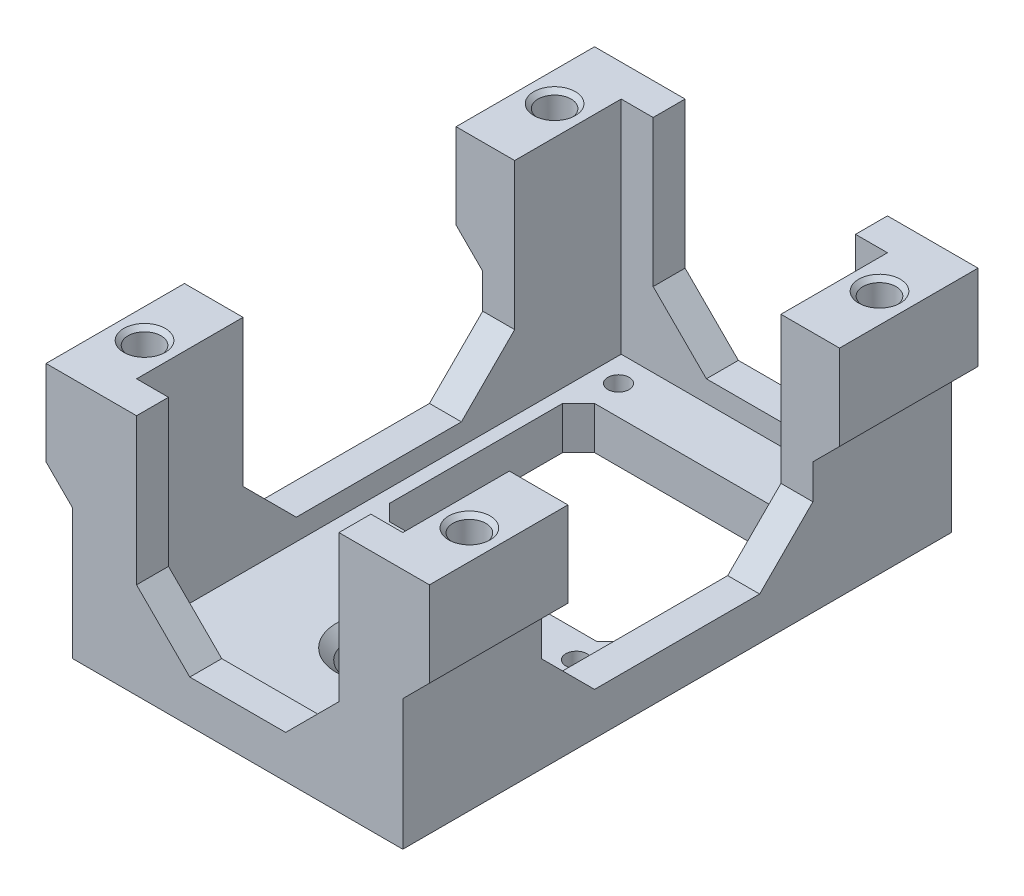
from build123d import *

# Parameters (mm, degrees)
SKETCH1_W                                  = 25
SKETCH1_H                                  = 45.5
BOSS_EXTRUDE1_DEPTH                        = 4
SKETCH2_R                                  = 1
CUT_EXTRUDE1_DEPTH                         = 27.264281829
SKETCH3_W                                  = 22.5
SKETCH3_H                                  = 19.25
CUT_EXTRUDE2_DEPTH                         = 4
CHAMFER1_SIZE                              = 1.5
SKETCH4_R                                  = 3
CUT_EXTRUDE3_DEPTH                         = 27.264281829
SKETCH11_W                                 = 31
SKETCH11_H                                 = 51.5
SKETCH11_W_2                               = 25
SKETCH11_H_2                               = 45.5
BOSS_EXTRUDE5_DEPTH                        = 6
BOSS_EXTRUDE6_DEPTH                        = 18.75
SKETCH14_W                                 = 5.5
SKETCH14_H                                 = 13
BOSS_EXTRUDE7_DEPTH                        = 8
SKETCH15_R                                 = 1.55
CUT_EXTRUDE5_DEPTH                         = 3
MIRROR2_AT_THE_SECOND_PLANE_COPY_1_DEPTH   = 18.75
MIRROR2_AT_THE_SECOND_PLANE_COPY_2_SKETC_W = 5.5
MIRROR2_AT_THE_SECOND_PLANE_COPY_2_SKETC_H = 13
MIRROR2_AT_THE_SECOND_PLANE_COPY_2_DEPTH   = 8
MIRROR2_AT_THE_SECOND_PLANE_COPY_3_SKETC_R = 1.55
MIRROR2_AT_THE_SECOND_PLANE_COPY_3_DEPTH   = 3
CHAMFER3_SIZE                              = 2.5
CHAMFER4_SIZE                              = 5
CHAMFER5_SIZE                              = 2
SKETCH16_R                                 = 2
CUT_EXTRUDE6_DEPTH                         = 1.5
CHAMFER6_SIZE                              = 1
CHAMFER7_SIZE                              = 0.4
SKETCH17_R                                 = 1
CUT_EXTRUDE7_DEPTH                         = 4


with BuildPart() as part:
    # Sketch1 → Boss-Extrude1 (new body)
    with BuildSketch(Plane(origin=(0, 0, 0), x_dir=(1, 0, 0), z_dir=(0, 1, 0))):
        Rectangle(SKETCH1_W, SKETCH1_H)
    extrude(amount=BOSS_EXTRUDE1_DEPTH)

    # Sketch2 → Cut-Extrude1 (cut, through all)
    with BuildSketch(Plane(origin=(0, 4, 0), x_dir=(1, 0, 0), z_dir=(0, 1, 0))):
        with Locations(Location((-10.25, 20.25, 0), (0, 0, 270))):
            Circle(SKETCH2_R)
        with Locations(Location((10.25, 20.25, 0), (0, 0, 270))):
            Circle(SKETCH2_R)
        with Locations(Location((10.25, -4.2, 0), (0, 0, 270))):
            Circle(SKETCH2_R)
        with Locations(Location((-10.25, -4.2, 0), (0, 0, 270))):
            Circle(SKETCH2_R)
    extrude(amount=-CUT_EXTRUDE1_DEPTH, mode=Mode.SUBTRACT)

    # Sketch3 → Cut-Extrude2 (cut)
    with BuildSketch(Plane(origin=(0, 4, 0), x_dir=(1, 0, 0), z_dir=(0, 1, 0))):
        with Locations((0, 7.875)):
            Rectangle(SKETCH3_W, SKETCH3_H)
    extrude(amount=-CUT_EXTRUDE2_DEPTH, mode=Mode.SUBTRACT)

    # Chamfer1
    chamfer1_edges = [part.edges().sort_by_distance(p)[0] for p in [
        (11.25, 2, -17.5),
        (11.25, 2, 1.75),
        (-11.25, 2, 1.75),
        (-11.25, 2, -17.5),
    ]]
    chamfer(chamfer1_edges, length=CHAMFER1_SIZE)

    # Sketch4 → Cut-Extrude3 (cut, through all)
    with BuildSketch(Plane(origin=(0, 4, 0), x_dir=(1, 0, 0), z_dir=(0, 1, 0))):
        with Locations(Location((0, -12.5, 0), (0, 0, 270))):
            Circle(SKETCH4_R)
    extrude(amount=-CUT_EXTRUDE3_DEPTH, mode=Mode.SUBTRACT)

    # Sketch11 → Boss-Extrude5 (add)
    with BuildSketch(Plane.XZ):
        Rectangle(SKETCH11_W, SKETCH11_H)
        Rectangle(SKETCH11_W_2, SKETCH11_H_2, mode=Mode.SUBTRACT)
    extrude(amount=-BOSS_EXTRUDE5_DEPTH)

    # Sketch12 → Boss-Extrude6 (add)
    with BuildSketch(Plane(origin=(0, 6, 0), x_dir=(1, 0, 0), z_dir=(0, 1, 0))):
        Polygon((-15.5, 25.75), (-9.5, 25.75), (-9.5, 22.75), (-12.5, 22.75), (-12.5, 12.75), (-15.5, 12.75), align=None)
    boss_extrude6 = extrude(amount=BOSS_EXTRUDE6_DEPTH)

    # Sketch14 → Boss-Extrude7 (add)
    with BuildSketch(Plane(origin=(0, 24.75, 0), x_dir=(1, 0, 0), z_dir=(0, 1, 0))):
        with Locations((-15.25, 19.25)):
            Rectangle(SKETCH14_W, SKETCH14_H)
    boss_extrude7 = extrude(amount=-BOSS_EXTRUDE7_DEPTH)

    # Sketch15 → Cut-Extrude5 (cut)
    with BuildSketch(Plane(origin=(0, 24.75, 0), x_dir=(1, 0, 0), z_dir=(0, 1, 0))):
        with Locations(Location((-15.25, 19.25, 0), (0, 0, 270))):
            Circle(SKETCH15_R)
    cut_extrude5 = extrude(amount=-CUT_EXTRUDE5_DEPTH, mode=Mode.SUBTRACT)

    # Mirror2: Boss-Extrude6, Boss-Extrude7, Cut-Extrude5 across plane
    add(boss_extrude6.mirror(Plane(origin=(0, 0, 0), x_dir=(0, 0, 1), z_dir=(1, 0, 0))))
    add(boss_extrude7.mirror(Plane(origin=(0, 0, 0), x_dir=(0, 0, 1), z_dir=(1, 0, 0))))
    add(cut_extrude5.mirror(Plane(origin=(0, 0, 0), x_dir=(0, 0, 1), z_dir=(1, 0, 0))), mode=Mode.SUBTRACT)

    # Mirror2 at the second plane: Boss-Extrude6, Boss-Extrude7, Cut-Extrude5 across plane
    add(boss_extrude6.mirror(Plane.XY))
    add(boss_extrude7.mirror(Plane.XY))
    add(cut_extrude5.mirror(Plane.XY), mode=Mode.SUBTRACT)

    # Mirror2 at the second plane copy 1 sketc → Mirror2 at the second plane copy 1 (add)
    with BuildSketch(Plane(origin=(0, 6, 0), x_dir=(-1, 0, 0), z_dir=(0, 1, 0))):
        Polygon((-15.5, 25.75), (-9.5, 25.75), (-9.5, 22.75), (-12.5, 22.75), (-12.5, 12.75), (-15.5, 12.75), align=None)
    extrude(amount=MIRROR2_AT_THE_SECOND_PLANE_COPY_1_DEPTH)

    # Mirror2 at the second plane copy 2 sketc → Mirror2 at the second plane copy 2 (add)
    with BuildSketch(Plane(origin=(0, 24.75, 0), x_dir=(-1, 0, 0), z_dir=(0, 1, 0))):
        with Locations((-15.25, 19.25)):
            Rectangle(MIRROR2_AT_THE_SECOND_PLANE_COPY_2_SKETC_W, MIRROR2_AT_THE_SECOND_PLANE_COPY_2_SKETC_H)
    extrude(amount=-MIRROR2_AT_THE_SECOND_PLANE_COPY_2_DEPTH)

    # Mirror2 at the second plane copy 3 sketc → Mirror2 at the second plane copy 3 (cut)
    with BuildSketch(Plane(origin=(0, 24.75, 0), x_dir=(-1, 0, 0), z_dir=(0, 1, 0))):
        with Locations(Location((-15.25, 19.25, 0), (0, 0, 270))):
            Circle(MIRROR2_AT_THE_SECOND_PLANE_COPY_3_SKETC_R)
    extrude(amount=-MIRROR2_AT_THE_SECOND_PLANE_COPY_3_DEPTH, mode=Mode.SUBTRACT)

    # Chamfer3
    # the kernel refuses this chamfer: 2.5 mm, written as the material it adds along each edge
    with BuildSketch(Plane(origin=(-15.5, 16.75, -12.75), x_dir=(0.027495876610586317, -0.9996219169112968, 0), z_dir=(0, 0, -1))) as chamfer3_piece_1_section:
        Polygon((CHAMFER3_SIZE * 0.999621916911, CHAMFER3_SIZE * 0.0274958766106), (-CHAMFER3_SIZE * 0.0274958766106, CHAMFER3_SIZE * 0.999621916911), (0, 0), align=None)
    chamfer3_piece_1 = extrude(amount=13, mode=Mode.PRIVATE)
    chamfer3_piece_1 = split(chamfer3_piece_1, bisect_by=Plane(origin=(-18, 15.923989614, -19.25), z_dir=(1, 0, 0)), keep=Keep.TOP, mode=Mode.PRIVATE)
    add(chamfer3_piece_1)
    with BuildSketch(Plane(origin=(-15.5, 16.75, 12.75), x_dir=(0.027495876610586317, -0.9996219169112968, 0), z_dir=(0, 0, 1))) as chamfer3_piece_2_section:
        Polygon((CHAMFER3_SIZE * 0.999621916911, -CHAMFER3_SIZE * 0.0274958766106), (-CHAMFER3_SIZE * 0.0274958766106, -CHAMFER3_SIZE * 0.999621916911), (0, 0), align=None)
    chamfer3_piece_2 = extrude(amount=13, mode=Mode.PRIVATE)
    chamfer3_piece_2 = split(chamfer3_piece_2, bisect_by=Plane(origin=(-18, 15.923989614, 19.25), z_dir=(1, 0, 0)), keep=Keep.TOP, mode=Mode.PRIVATE)
    add(chamfer3_piece_2)
    with BuildSketch(Plane(origin=(15.5, 16.75, -12.75), x_dir=(-0.027495876610586317, -0.9996219169112968, 0), z_dir=(0, 0, -1))) as chamfer3_piece_3_section:
        Polygon((CHAMFER3_SIZE * 0.999621916911, -CHAMFER3_SIZE * 0.0274958766106), (-CHAMFER3_SIZE * 0.0274958766106, -CHAMFER3_SIZE * 0.999621916911), (0, 0), align=None)
    chamfer3_piece_3 = extrude(amount=13, mode=Mode.PRIVATE)
    chamfer3_piece_3 = split(chamfer3_piece_3, bisect_by=Plane(origin=(18, 15.923989614, -19.25), z_dir=(-1, 0, 0)), keep=Keep.TOP, mode=Mode.PRIVATE)
    add(chamfer3_piece_3)
    with BuildSketch(Plane(origin=(15.5, 16.75, 12.75), x_dir=(-0.027495876610586317, -0.9996219169112968, 0), z_dir=(0, 0, 1))) as chamfer3_piece_4_section:
        Polygon((CHAMFER3_SIZE * 0.999621916911, CHAMFER3_SIZE * 0.0274958766106), (-CHAMFER3_SIZE * 0.0274958766106, CHAMFER3_SIZE * 0.999621916911), (0, 0), align=None)
    chamfer3_piece_4 = extrude(amount=13, mode=Mode.PRIVATE)
    chamfer3_piece_4 = split(chamfer3_piece_4, bisect_by=Plane(origin=(18, 15.923989614, 19.25), z_dir=(-1, 0, 0)), keep=Keep.TOP, mode=Mode.PRIVATE)
    add(chamfer3_piece_4)

    # Chamfer4
    chamfer4_edges = [part.edges().sort_by_distance(p)[0] for p in [
        (-14, 6, -12.75),
        (-9.5, 6, -24.25),
        (-14, 6, 12.75),
        (-9.5, 6, 24.25),
        (14, 6, -12.75),
        (9.5, 6, -24.25),
        (14, 6, 12.75),
        (9.5, 6, 24.25),
    ]]
    chamfer(chamfer4_edges, length=CHAMFER4_SIZE)

    # Chamfer5
    chamfer5_edges = [part.edges().sort_by_distance(p)[0] for p in [
        (0, 0, -25.75),
        (15.5, 0, 0),
        (0, 0, 25.75),
        (-15.5, 0, 0),
    ]]
    chamfer(chamfer5_edges, length=CHAMFER5_SIZE)

    # Sketch16 → Cut-Extrude6 (cut)
    with BuildSketch(Plane.XZ):
        with Locations(Location((-10.25, 4.2, 0), (0, 0, 270))):
            Circle(SKETCH16_R)
        with Locations(Location((10.25, 4.2, 0), (0, 0, 270))):
            Circle(SKETCH16_R)
        with Locations(Location((10.25, -20.25, 0), (0, 0, 270))):
            Circle(SKETCH16_R)
        with Locations(Location((-10.25, -20.25, 0), (0, 0, 270))):
            Circle(SKETCH16_R)
    extrude(amount=-CUT_EXTRUDE6_DEPTH, mode=Mode.SUBTRACT)

    # Chamfer6
    chamfer6_edges = [part.edges().sort_by_distance(p)[0] for p in [
        (0, 0, 9.5),
        (0, 4, 9.5),
    ]]
    chamfer(chamfer6_edges, length=CHAMFER6_SIZE)

    # Chamfer7
    chamfer7_edges = [part.edges().sort_by_distance(p)[0] for p in [
        (-15.25, 24.75, -20.8),
        (-15.25, 24.75, 20.8),
        (15.25, 24.75, -20.8),
        (15.25, 24.75, 20.8),
    ]]
    chamfer(chamfer7_edges, length=CHAMFER7_SIZE)

    # Sketch17 → Cut-Extrude7 (cut)
    with BuildSketch(Plane(origin=(0, 21.75, 0), x_dir=(1, 0, 0), z_dir=(0, 1, 0))):
        with Locations(Location((-15.25, 19.25, 0), (0, 0, 270))):
            Circle(SKETCH17_R)
        with Locations(Location((15.25, 19.25, 0), (0, 0, 270))):
            Circle(SKETCH17_R)
        with Locations(Location((15.25, -19.25, 0), (0, 0, 270))):
            Circle(SKETCH17_R)
        with Locations(Location((-15.25, -19.25, 0), (0, 0, 270))):
            Circle(SKETCH17_R)
    extrude(amount=-CUT_EXTRUDE7_DEPTH, mode=Mode.SUBTRACT)


solid = part.part
